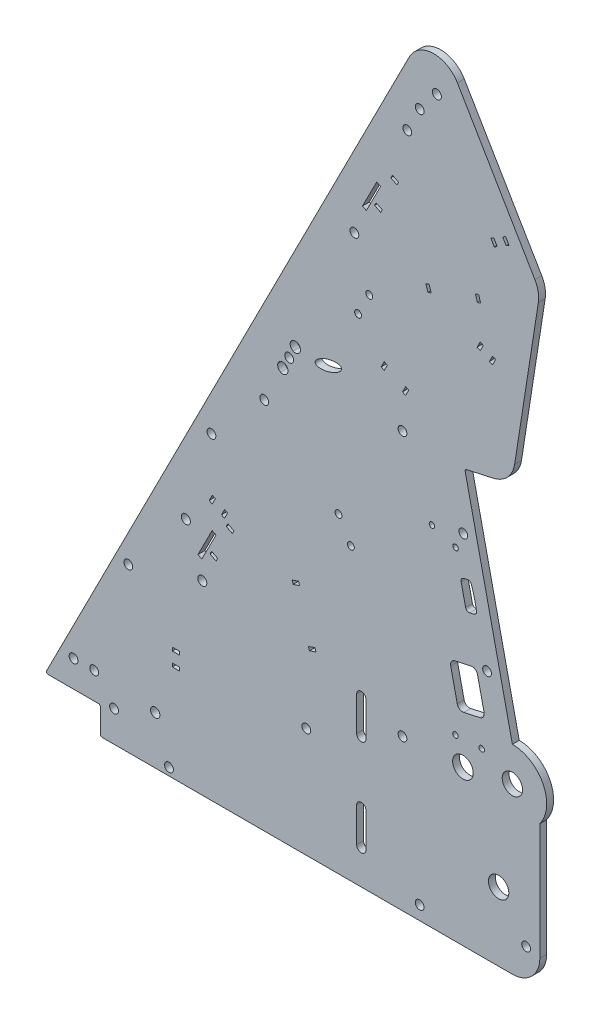
from build123d import *

# Parameters (mm, degrees)
BOSS_EXTRUDE1_DEPTH     = 3.175
SKETCH2_R               = 2.0955
SKETCH2_R_2             = 2.032
SKETCH2_R_3             = 4.699
CUT_EXTRUDE1_DEPTH      = 421.976111717
SKETCH7_R               = 2.159
CUT_EXTRUDE2_DEPTH      = 421.976111717
CUT_EXTRUDE3_REACH      = 422.976
SKETCH10_R              = 2.032
FILLET1_R               = 12.7
FILLET2_R               = 0.79375
SKETCH12_R              = 2.032
CUT_EXTRUDE5_DEPTH      = 410.593447353
CUT_EXTRUDE6_DEPTH      = 410.593447353
CUT_EXTRUDE6_DEPTH_BACK = 410.593447353
SKETCH13_R              = 1.27
SKETCH14_R              = 2.032
SKETCH14_R_2            = 1.6
SKETCH14_RX             = 6.35
SKETCH14_RY             = 2.38125
SKETCH14_W              = 3.175
SKETCH14_H              = 1.5875
CUT_EXTRUDE7_DEPTH      = 410.593447353
SKETCH15_R              = 2.032
CUT_EXTRUDE8_DEPTH      = 410.593447493
FILLET3_R               = 2.54
SKETCH16_R              = 4.7625
CUT_EXTRUDE9_DEPTH      = 410.593447493


with BuildPart() as part:
    # Sketch1 → Boss-Extrude1 (new body)
    with BuildSketch(Plane.XY):
        with BuildLine():
            Line((228.6, -12.7), (228.6, 53.975))
            ThreePointArc((228.6, 53.975), (230.099031657, 70.599515829), (215.9, 79.375))
            Line((215.9, 79.375), (193.909735224, 178.566674323))
            Line((193.909735224, 178.566674323), (215.607913982, 183.377044743))
            Line((215.607913982, 183.377044743), (228.6, 266.7))
            Line((228.6, 266.7), (178.754725958, 351.413083686))
            Line((178.754725958, 351.413083686), (0, 0))
            Line((0, 0), (25.4, 0))
            Line((25.4, 0), (25.4, -12.7))
            Line((25.4, -12.7), (228.6, -12.7))
        make_face()
    extrude(amount=BOSS_EXTRUDE1_DEPTH)

    # Sketch2 → Cut-Extrude1 (cut, through all)
    with BuildSketch(Plane.XY.offset(3.175)):
        with Locations((64.943150167, 94.057839899)):
            Circle(SKETCH2_R)
        with Locations((180.975, 322.164313376)):
            Circle(SKETCH2_R)
        with Locations((72.544547852, 73.173171402)):
            Circle(SKETCH2_R)
        with Locations((193.207821773, 152.394364194)):
            Circle(SKETCH2_R_2)
        with Locations((215.9, 63.5)):
            Circle(SKETCH2_R_3)
        with Locations((173.0375, -6.35)):
            Circle(SKETCH2_R_2)
        with Locations((204.202954161, 102.798527032)):
            Circle(SKETCH2_R_2)
        with Locations((209.55, 19.05)):
            Circle(SKETCH2_R_3)
        with Locations((165.1, 179.3875)):
            Circle(SKETCH2_R_2)
    extrude(amount=-CUT_EXTRUDE1_DEPTH, mode=Mode.SUBTRACT)

    # Sketch7 → Cut-Extrude2 (cut, through all)
    with BuildSketch(Plane.XY.offset(3.175)):
        with Locations((50.8, 9.525)):
            Circle(SKETCH7_R)
        with BuildLine():
            Line((143.891, 3.175), (143.891, 19.05))
            ThreePointArc((143.891, 19.05), (146.05, 21.209), (148.209, 19.05))
            Line((148.209, 19.05), (148.209, 3.175))
            ThreePointArc((148.209, 3.175), (146.05, 1.016), (143.891, 3.175))
        make_face()
        with BuildLine():
            Line((143.891, 47.625), (143.891, 63.5))
            ThreePointArc((143.891, 63.5), (146.05, 65.659), (148.209, 63.5))
            Line((148.209, 63.5), (148.209, 47.625))
            ThreePointArc((148.209, 47.625), (146.05, 45.466), (143.891, 47.625))
        make_face()
    extrude(amount=-CUT_EXTRUDE2_DEPTH, mode=Mode.SUBTRACT)

    # Sketch10 → Cut-Extrude3 (cut, up to next)
    with BuildSketch(Plane.XY.offset(3.175), mode=Mode.PRIVATE) as cut_extrude3_sk1:
        with Locations((165.1, 57.15)):
            Circle(SKETCH10_R)
    cut_extrude3_tool1 = extrude(cut_extrude3_sk1.sketch, amount=-CUT_EXTRUDE3_REACH, mode=Mode.PRIVATE) & part.part
    # Sketch10 → Cut-Extrude3 (cut, up to next)
    with BuildSketch(Plane.XY.offset(3.175), mode=Mode.PRIVATE) as cut_extrude3_sk2:
        with Locations((120.65, 38.1)):
            Circle(SKETCH10_R)
    cut_extrude3_tool2 = extrude(cut_extrude3_sk2.sketch, amount=-CUT_EXTRUDE3_REACH, mode=Mode.PRIVATE) & part.part
    # Sketch10 → Cut-Extrude3 (cut, up to next)
    with BuildSketch(Plane.XY.offset(3.175), mode=Mode.PRIVATE) as cut_extrude3_sk3:
        with Locations((13.046467246, 12.334704411)):
            Circle(SKETCH10_R)
    cut_extrude3_tool3 = extrude(cut_extrude3_sk3.sketch, amount=-CUT_EXTRUDE3_REACH, mode=Mode.PRIVATE) & part.part
    # Sketch10 → Cut-Extrude3 (cut, up to next)
    with BuildSketch(Plane.XY.offset(3.175), mode=Mode.PRIVATE) as cut_extrude3_sk4:
        with Locations((22.571467246, 12.334704411)):
            Circle(SKETCH10_R)
    cut_extrude3_tool4 = extrude(cut_extrude3_sk4.sketch, amount=-CUT_EXTRUDE3_REACH, mode=Mode.PRIVATE) & part.part
    # Sketch10 → Cut-Extrude3 (cut, up to next)
    with BuildSketch(Plane.XY.offset(3.175), mode=Mode.PRIVATE) as cut_extrude3_sk5:
        with Locations((38.360434174, 62.564025462)):
            Circle(SKETCH10_R)
    cut_extrude3_tool5 = extrude(cut_extrude3_sk5.sketch, amount=-CUT_EXTRUDE3_REACH, mode=Mode.PRIVATE) & part.part
    add(cut_extrude3_tool1.solids().sort_by_distance((165.1, 57.15, 3.175))[0], mode=Mode.SUBTRACT)
    add(cut_extrude3_tool2.solids().sort_by_distance((120.65, 38.1, 3.175))[0], mode=Mode.SUBTRACT)
    add(cut_extrude3_tool3.solids().sort_by_distance((13.046467, 12.334704, 3.175))[0], mode=Mode.SUBTRACT)
    add(cut_extrude3_tool4.solids().sort_by_distance((22.571467, 12.334704, 3.175))[0], mode=Mode.SUBTRACT)
    add(cut_extrude3_tool5.solids().sort_by_distance((38.360434, 62.564025, 3.175))[0], mode=Mode.SUBTRACT)

    # Fillet1
    fillet1_edges = [part.edges().sort_by_distance(p)[0] for p in [
        (228.6, -12.7, 1.5875),
        (178.754725958, 351.413083686, 1.5875),
        (215.607913982, 183.377044743, 1.5875),
        (228.6, 266.7, 1.5875),
    ]]
    fillet(fillet1_edges, radius=FILLET1_R)

    # Fillet2
    fillet2_edges = [part.edges().sort_by_distance(p)[0] for p in [
        (25.4, -12.7, 1.5875),
        (25.4, 0, 1.5875),
        (193.909735224, 178.566674323, 1.5875),
        (0, 0, 1.5875),
    ]]
    fillet(fillet2_edges, radius=FILLET2_R)

    # Sketch12 → Cut-Extrude5 (cut, through all)
    with BuildSketch(Plane.XY.offset(3.175)):
        with Locations((31.75, 1.5875)):
            Circle(SKETCH12_R)
        with Locations((222.25, 1.5875)):
            Circle(SKETCH12_R)
        with Locations((57.15, -9.2075)):
            Circle(SKETCH12_R)
    extrude(amount=-CUT_EXTRUDE5_DEPTH, mode=Mode.SUBTRACT)

    # Sketch13 → Cut-Extrude6 (cut, two sides: drawn at the far end of the back side and taken through both)
    with BuildSketch(Plane.XY.offset(3.175).offset(-CUT_EXTRUDE6_DEPTH_BACK)):
        with Locations((189.602197334, 69.980636704)):
            Circle(SKETCH13_R)
        with Locations((201.708862449, 70.509225118)):
            Circle(SKETCH13_R)
        with Locations((178.721644858, 148.532438598)):
            Circle(SKETCH13_R)
        with Locations((189.622629605, 145.09537131)):
            Circle(SKETCH13_R)
        Polygon((186.844411154, 98.950230697), (199.243370445, 101.699013794), (203.36654509, 83.100574858), (190.9675858, 80.351791761), align=None)
        with BuildLine():
            Line((195.12807169, 134.933592333), (193.415301921, 134.553880417))
            ThreePointArc((193.415301921, 134.553880417), (192.420015888, 133.856973634), (192.209029897, 132.660412618))
            Line((192.209029897, 132.660412618), (194.270617219, 123.361193151))
            ThreePointArc((194.270617219, 123.361193151), (194.967524002, 122.365907117), (196.164085018, 122.154921126))
            Line((196.164085018, 122.154921126), (198.109091879, 122.586118766))
            ThreePointArc((198.109091879, 122.586118766), (199.082720469, 123.249946547), (199.330550026, 124.401988414))
            ThreePointArc((199.330550026, 124.401988414), (198.332361402, 129.18494451), (196.979617949, 133.879956193))
            ThreePointArc((196.979617949, 133.879956193), (196.256822614, 134.763465498), (195.12807169, 134.933592333))
        make_face()
    extrude(amount=CUT_EXTRUDE6_DEPTH + CUT_EXTRUDE6_DEPTH_BACK, mode=Mode.SUBTRACT)

    # Sketch14 → Cut-Extrude7 (cut, through all)
    with BuildSketch(Plane.XY.offset(3.175)):
        with Locations((142.875, 247.65)):
            Circle(SKETCH14_R)
        with Locations((112.7125, 182.5625)):
            Circle(SKETCH14_R)
        with Locations((101.196445848, 159.923142748)):
            Circle(SKETCH14_R)
        with Locations((149.733547292, 226.206931243)):
            Circle(SKETCH14_R_2)
        with Locations((144.564924562, 216.045959878)):
            Circle(SKETCH14_R_2)
        with Locations((135.545743513, 131.358540309)):
            Circle(SKETCH14_R_2)
        with Locations((141.245743513, 121.485850706)):
            Circle(SKETCH14_R_2)
        with Locations(Location((130.826142263, 188.461522288), (0, 0, -161.961260538))):
            Ellipse(SKETCH14_RX, SKETCH14_RY)
        Polygon((146.622265242, 260.232698141), (153.186416108, 273.137131774), (154.969042664, 272.230355857), (148.404891797, 259.325922223), align=None)
        Polygon((159.730005627, 278.088494461), (160.449759012, 279.503454289), (163.279678668, 278.06394752), (162.559925284, 276.648987692), align=None)
        Polygon((152.929186246, 264.718795297), (155.759105903, 263.279288528), (155.039352518, 261.8643287), (152.209432862, 263.303835468), align=None)
        Polygon((177.409251759, 244.300646718), (178.37991482, 241.277661733), (176.868422327, 240.792330202), (175.897759266, 243.815315188), align=None)
        Polygon((199.749157586, 248.139202459), (198.778494525, 251.162187445), (200.289987018, 251.647518975), (201.260650079, 248.62453399), align=None)
        Polygon((77.09289629, 95.533904772), (78.875522846, 94.627128854), (72.311371979, 81.722695221), (70.528745424, 82.629471138), align=None)
        Polygon((84.356239194, 101.900227287), (83.636485809, 100.485267459), (86.466405466, 99.04576069), (87.18615885, 100.460720518), align=None)
        Polygon((156.643043941, 199.39992488), (158.08255071, 202.229844536), (156.667590882, 202.949597921), (155.228084113, 200.119678264), align=None)
        Polygon((165.132802911, 195.081404573), (166.57230968, 197.911324229), (167.987269508, 197.191570845), (166.547762739, 194.361651188), align=None)
        Polygon((76.835666428, 87.115568294), (76.115913044, 85.700608466), (78.9458327, 84.261101697), (79.665586085, 85.676061525), align=None)
        Polygon((201.054905742, 233.058073491), (199.615398973, 230.228153834), (201.030358802, 229.50840045), (202.469865571, 232.338320106), align=None)
        Polygon((205.275238286, 227.349140296), (206.714745055, 230.179059953), (208.129704884, 229.459306568), (206.690198115, 226.629386912), align=None)
        Polygon((205.933460322, 277.048802761), (207.543586351, 274.312359966), (208.911807749, 275.11742298), (207.30168172, 277.853865775), align=None)
        Polygon((211.406345913, 280.269054818), (213.016471942, 277.532612023), (214.384693339, 278.337675038), (212.77456731, 281.074117833), align=None)
        Polygon((121.59290846, 71.412072491), (122.090738884, 69.90465048), (125.105582906, 70.900311329), (124.607752481, 72.40773334), align=None)
        Polygon((114.056829911, 94.231189433), (114.554660336, 92.723767423), (117.569504357, 93.719428272), (117.071673933, 95.226850283), align=None)
        with Locations((60.325, 38.89375)):
            Rectangle(SKETCH14_W, SKETCH14_H)
        with Locations((60.325, 32.54375)):
            Rectangle(SKETCH14_W, SKETCH14_H)
        Polygon((77.191084053, 109.732596936), (75.751577284, 106.902677279), (77.166537113, 106.182923895), (78.606043882, 109.012843551), align=None)
        Polygon((81.411416597, 104.023663741), (82.850923366, 106.853583398), (84.265883195, 106.133830013), (82.826376426, 103.303910357), align=None)
        with BuildLine():
            add(Edge.make_bspline(
                [(108.753856385, 174.780220945), (110.821723963, 173.728350313), (111.90135404, 175.850790056), (112.980984117, 177.973229798), (110.913116539, 179.025100429)],
                knots=[0, 0, 0, 1.570796327, 1.570796327, 3.141592654, 3.141592654, 3.141592654], degree=2, weights=[1, 0.707106781, 1, 0.707106781, 1]))
            add(Edge.make_bspline(
                [(110.913116539, 179.025100429), (110.77268373, 179.096534959), (110.626511301, 179.154391231), (110.322493118, 179.242488117), (110.165373026, 179.272144601), (109.695542578, 179.315227584), (109.373415846, 179.283109915), (108.9218002, 179.145618276), (108.77365547, 179.084104344), (108.495402792, 178.934315945), (108.365007933, 178.846412483), (108.121928357, 178.644218756), (108.0096946, 178.529696631), (107.813416216, 178.283892413), (107.727754596, 178.151249117), (107.58342172, 177.86715543), (107.526957985, 177.720181494), (107.444132542, 177.416788403), (107.417775942, 177.25846019), (107.397765558, 176.943245973), (107.403605499, 176.786285249), (107.446503964, 176.473637327), (107.48413539, 176.317513381), (107.58741463, 176.020451076), (107.653173274, 175.877669132), (107.813265642, 175.6037409), (107.906595752, 175.474826714), (108.217757093, 175.120973916), (108.473611136, 174.922774438), (108.753856385, 174.780220945)],
                knots=[0, 0, 0, 0, 0.0625, 0.0625, 0.125, 0.125, 0.25, 0.25, 0.3125, 0.3125, 0.375, 0.375, 0.4375, 0.4375, 0.5, 0.5, 0.5625, 0.5625, 0.625, 0.625, 0.6875, 0.6875, 0.75, 0.75, 0.8125, 0.8125, 0.875, 0.875, 1, 1, 1, 1], degree=3))
        make_face()
        with BuildLine():
            add(Edge.make_bspline(
                [(114.511883461, 186.099899571), (116.579751039, 185.048028939), (117.659381116, 187.170468682), (118.739011193, 189.292908424), (116.671143615, 190.344779055)],
                knots=[0, 0, 0, 1.570796327, 1.570796327, 3.141592654, 3.141592654, 3.141592654], degree=2, weights=[1, 0.707106781, 1, 0.707106781, 1]))
            add(Edge.make_bspline(
                [(114.511883461, 186.099899571), (114.371072576, 186.171526418), (114.235866303, 186.257351722), (113.987547839, 186.450065421), (113.872855617, 186.557654504), (113.558328181, 186.915480737), (113.397407635, 187.190062471), (113.24126374, 187.640077887), (113.204646123, 187.792957095), (113.161785412, 188.104373095), (113.155794463, 188.264784445), (113.176022459, 188.579744294), (113.201753482, 188.734678369), (113.28477823, 189.039401247), (113.342554455, 189.189068059), (113.556262174, 189.609540487), (113.758638915, 189.862727621), (114.121215939, 190.164706401), (114.254157477, 190.254446578), (114.53236698, 190.404090785), (114.677524715, 190.464472802), (114.97978581, 190.556739169), (115.136913319, 190.588175808), (115.449881014, 190.619878989), (115.607376248, 190.620744977), (115.924438129, 190.591785045), (116.079517328, 190.562319108), (116.3815103, 190.475083726), (116.53003913, 190.416555249), (116.671143615, 190.344779055)],
                knots=[0, 0, 0, 0, 0.0625, 0.0625, 0.125, 0.125, 0.25, 0.25, 0.3125, 0.3125, 0.375, 0.375, 0.4375, 0.4375, 0.5, 0.5, 0.625, 0.625, 0.6875, 0.6875, 0.75, 0.75, 0.8125, 0.8125, 0.875, 0.875, 0.9375, 0.9375, 1, 1, 1, 1], degree=3))
        make_face()
    extrude(amount=-CUT_EXTRUDE7_DEPTH, mode=Mode.SUBTRACT)

    # Sketch15 → Cut-Extrude8 (cut, through all)
    with BuildSketch(Plane.XY.offset(3.175)):
        with Locations((76.786819993, 134.148053636)):
            Circle(SKETCH15_R)
        with Locations((173.086747087, 312.259099812)):
            Circle(SKETCH15_R)
        with Locations((167.328720011, 300.939421187)):
            Circle(SKETCH15_R)
    extrude(amount=-CUT_EXTRUDE8_DEPTH, mode=Mode.SUBTRACT)

    # Fillet3
    fillet3_edges = [part.edges().sort_by_distance(p)[0] for p in [
        (199.243370445, 101.699013794, 1.5875),
        (186.844411154, 98.950230697, 1.5875),
        (190.9675858, 80.351791761, 1.5875),
        (203.36654509, 83.100574858, 1.5875),
    ]]
    fillet(fillet3_edges, radius=FILLET3_R)

    # Sketch16 → Cut-Extrude9 (cut, through all)
    with BuildSketch(Plane.XY.offset(3.175)):
        with Locations((193.04, 58.801)):
            Circle(SKETCH16_R)
    extrude(amount=-CUT_EXTRUDE9_DEPTH, mode=Mode.SUBTRACT)


solid = part.part
